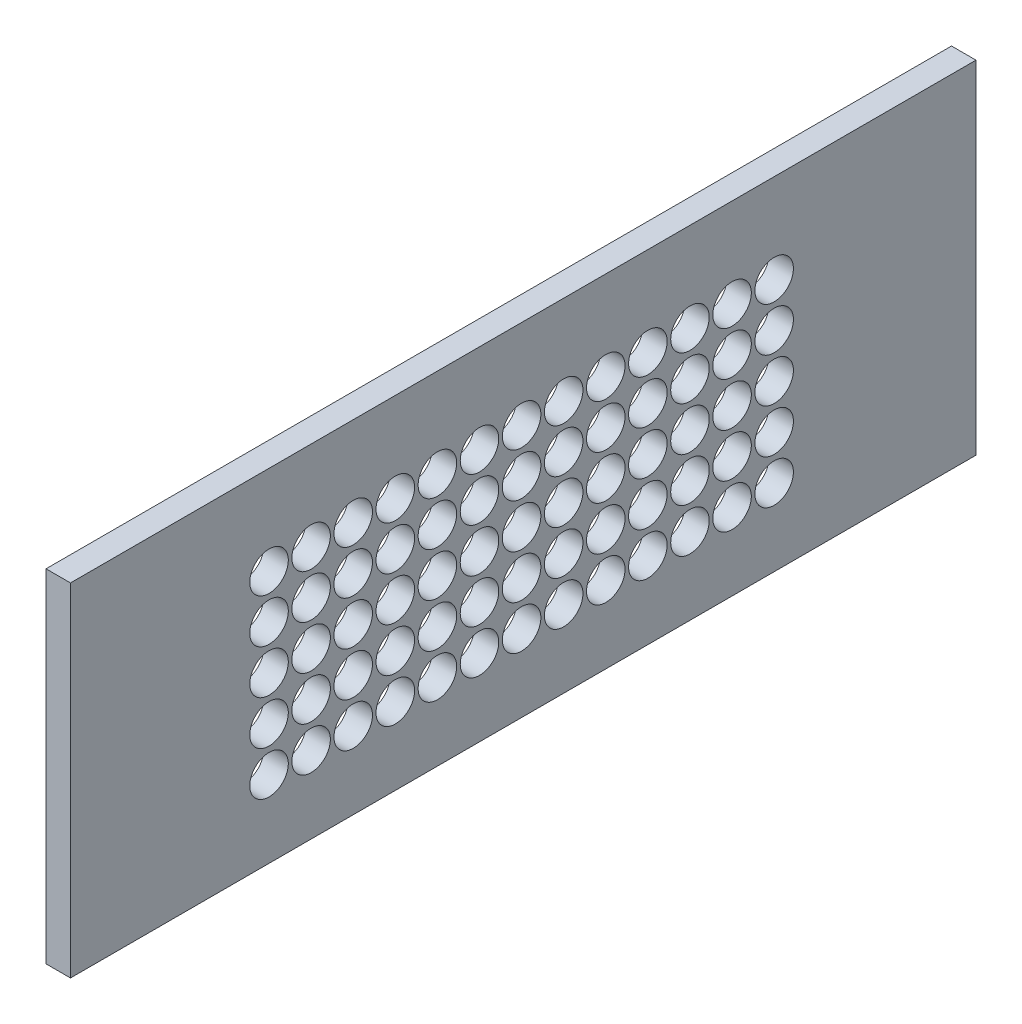
from build123d import *

# Parameters (mm, degrees)
SKETCH1_W            = 6.35
SKETCH1_H            = 88.77554
BOSS_EXTRUDE1_DEPTH  = 234.95
SKETCH3_R            = 5
CUT_EXTRUDE1_DEPTH   = 240.190508017
LPATTERN1_COUNT      = 5
LPATTERN1_PITCH      = 11.43
LPATTERN1_COUNT_DIR2 = 13
LPATTERN1_PITCH_DIR2 = 10.922


with BuildPart() as part:
    # Sketch1 → Boss-Extrude1 (new body)
    with BuildSketch(Plane.XY):
        Rectangle(SKETCH1_W, SKETCH1_H)
    extrude(amount=BOSS_EXTRUDE1_DEPTH)

    # Sketch3 → Cut-Extrude1 (cut, through all)
    with BuildSketch(Plane.ZY.offset(3.175)):
        with Locations((52.369162839, 21.26223)):
            Circle(SKETCH3_R)
    cut_extrude1 = extrude(amount=-CUT_EXTRUDE1_DEPTH, mode=Mode.SUBTRACT)

    # LPattern1: Cut-Extrude1 5 × 13
    with Locations(*[(0, -i * LPATTERN1_PITCH, j * LPATTERN1_PITCH_DIR2) for i in range(LPATTERN1_COUNT) for j in range(LPATTERN1_COUNT_DIR2) if (i, j) != (0, 0)]):
        add(cut_extrude1, mode=Mode.SUBTRACT)


solid = part.part
